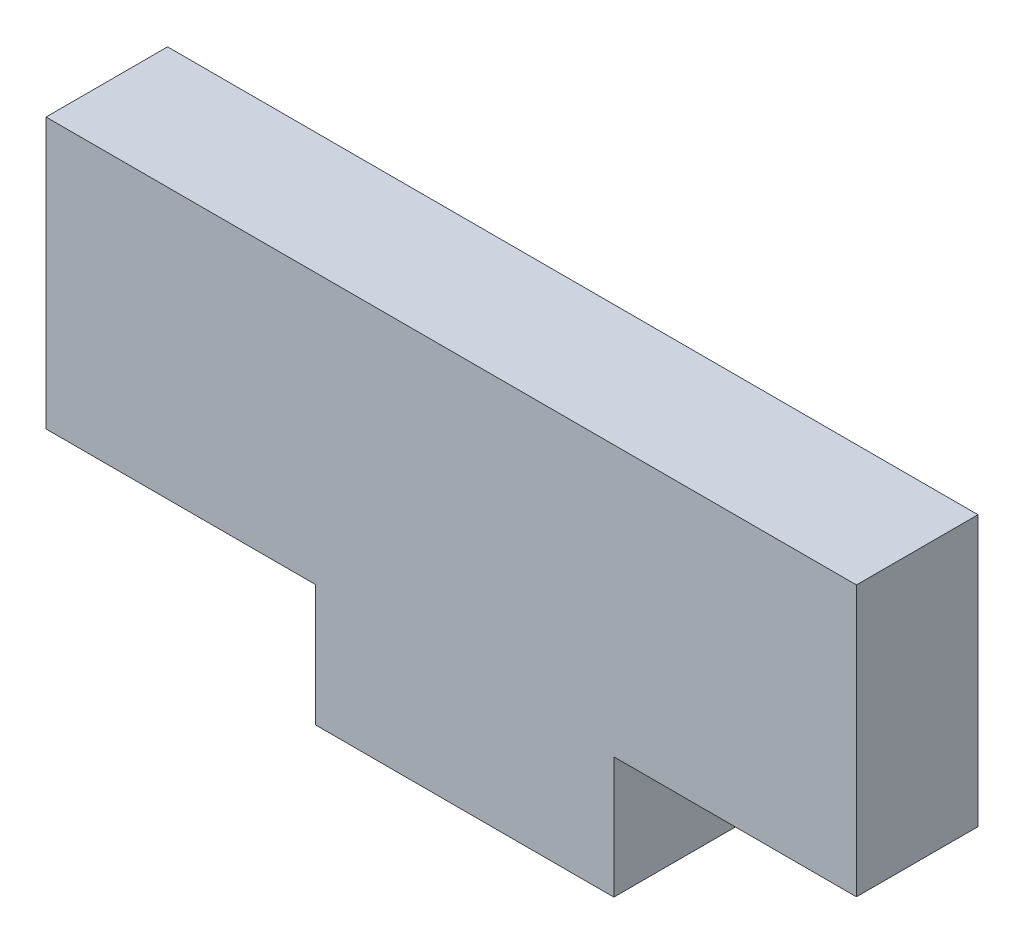
from build123d import *

# Parameters (mm, degrees)
BOSS_EXTRUDE1_DEPTH = 4.5


with BuildPart() as part:
    # Sketch1 → Boss-Extrude1 (new body)
    with BuildSketch(Plane.XY):
        Polygon((21.020160869, 0), (30, 0), (30, 10), (0, 10), (0, 0), (9.97731138, 0), (9.97731138, -4.5), (21.020160869, -4.5), align=None)
    extrude(amount=BOSS_EXTRUDE1_DEPTH)


solid = part.part
